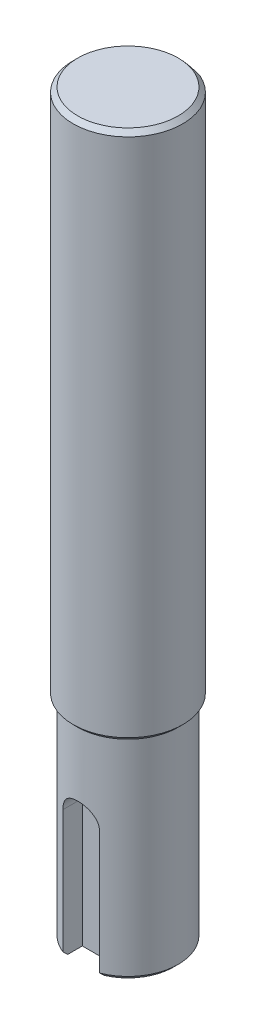
from build123d import *

# Parameters (mm, degrees)
SCHIZZO1_R                   = 6
ESTRUSIONE_ESTRUSIONE1_DEPTH = 58
SCHIZZO2_R                   = 5.5
ESTRUSIONE_ESTRUSIONE2_DEPTH = 23
TAGLIO_ESTRUSIONE1_START     = -5.5
SCHIZZO3_W                   = 5
SCHIZZO3_H                   = 5
TAGLIO_ESTRUSIONE1_DEPTH     = 5
TAGLIO_ESTRUSIONE2_DEPTH     = 2.5
SMUSSO1_SIZE                 = 0.5


with BuildPart() as part:
    # Schizzo1 → Estrusione-Estrusione1 (new body)
    with BuildSketch(Plane(origin=(0, 0, 0), x_dir=(1, 0, 0), z_dir=(0, 1, 0))):
        with Locations(Location((0, 0, 0), (0, 0, 90))):
            Circle(SCHIZZO1_R)
    extrude(amount=ESTRUSIONE_ESTRUSIONE1_DEPTH)

    # Schizzo2 → Estrusione-Estrusione2 (add)
    with BuildSketch(Plane.XZ):
        with Locations(Location((0, 0, 0), (0, 0, 270))):
            Circle(SCHIZZO2_R)
    extrude(amount=ESTRUSIONE_ESTRUSIONE2_DEPTH)

    # Schizzo3 → Taglio-Estrusione1 (cut)
    with BuildSketch(Plane.XY.offset(TAGLIO_ESTRUSIONE1_START)):
        with Locations((0, 55.5)):
            Rectangle(SCHIZZO3_W, SCHIZZO3_H)
    extrude(amount=-TAGLIO_ESTRUSIONE1_DEPTH, mode=Mode.SUBTRACT)

    # Schizzo5 → Taglio-Estrusione2 (cut)
    with BuildSketch(Plane.XY.offset(5.5)):
        with BuildLine():
            Line((-2, -23), (-2, -9))
            ThreePointArc((-2, -9), (0, -7), (2, -9))
            Line((2, -9), (2, -23))
            ThreePointArc((2, -23), (0, -25), (-2, -23))
        make_face()
    extrude(amount=-TAGLIO_ESTRUSIONE2_DEPTH, mode=Mode.SUBTRACT)

    # Smusso1
    smusso1_edges = [part.edges().sort_by_distance(p)[0] for p in [
        (0, 0, 6),
        (0, 58, 6),
        (5.405049242, -23, -1.017567048),
    ]]
    chamfer(smusso1_edges, length=SMUSSO1_SIZE - 0.0001)  # a hair under: the kernel refuses the full size


solid = part.part
